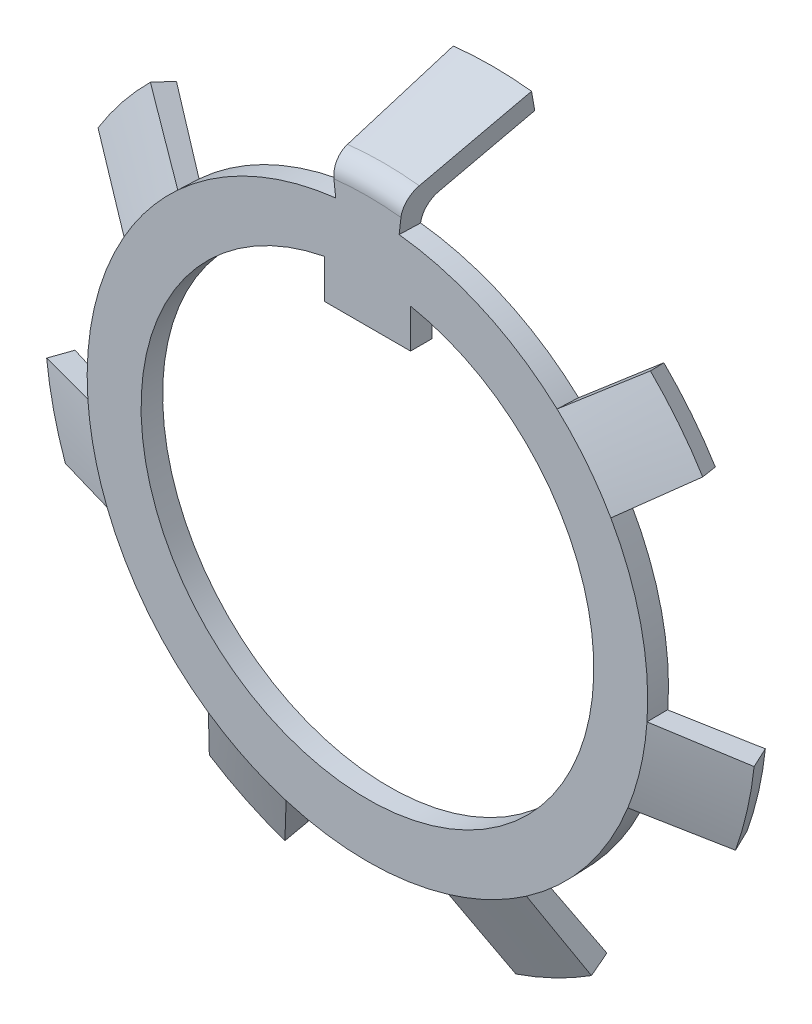
from build123d import *

# Parameters (mm, degrees)
CUT_EXTRUDE2_DEPTH           = 24.379246777
CUT_EXTRUDE2_DEPTH_BACK      = 24.379246777
CUT_EXTRUDE4_DEPTH           = 10
CUT_EXTRUDE4_DRAFT           = 2
CUT_EXTRUDE4_PROFILE_2_DEPTH = 10
CUT_EXTRUDE4_PROFILE_2_DRAFT = 2
CUT_EXTRUDE4_PROFILE_3_DEPTH = 10
CUT_EXTRUDE4_PROFILE_3_DRAFT = 2
CUT_EXTRUDE4_PROFILE_4_DEPTH = 10
CUT_EXTRUDE4_PROFILE_4_DRAFT = 2
CUT_EXTRUDE4_PROFILE_5_DEPTH = 10
CUT_EXTRUDE4_PROFILE_5_DRAFT = 2
CUT_EXTRUDE4_PROFILE_6_DEPTH = 10
CUT_EXTRUDE4_PROFILE_6_DRAFT = 2
REVOLVE3_ANGLE               = 13
FILLET1_R                    = 1


with BuildPart() as part:
    # Sketch1 → Revolve1 (revolve)
    with BuildSketch(Plane(origin=(0, 0, 0), x_dir=(0, 0, -1), z_dir=(1, 0, 0))):
        Polygon((-1, 7.5), (-1, 13), (0.529028795, 16.5), (1.445399555, 16.099669349), (0, 13), (0, 7.5), align=None)
    revolve(axis=Axis((0, 0, 1), (0, 0, -1)))

    # Sketch2 → Cut-Extrude2 (cut, two sides: drawn at the far end of the back side and taken through both)
    with BuildSketch(Plane.XY.offset(-CUT_EXTRUDE2_DEPTH_BACK)):
        with BuildLine():
            Line((-2, 8.5), (-2, 10.307764064))
            ThreePointArc((-2, 10.307764064), (0, -10.5), (2, 10.307764064))
            Line((2, 10.307764064), (2, 8.5))
            Line((2, 8.5), (-2, 8.5))
        make_face()
    extrude(amount=CUT_EXTRUDE2_DEPTH + CUT_EXTRUDE2_DEPTH_BACK, mode=Mode.SUBTRACT)


with BuildPart() as cut_extrude4_tool:
    # Sketch3 → Cut-Extrude4 (with draft: the straight prism first)
    with BuildSketch(Plane.XY.offset(1)):
        with BuildLine():
            Line((-11.558121734, 11.775390524), (-8.795827626, 9.57253448))
            ThreePointArc((-8.795827626, 9.57253448), (0, 13), (8.795827626, 9.57253448))
            Line((8.795827626, 9.57253448), (11.558121734, 11.775390524))
            ThreePointArc((11.558121734, 11.775390524), (0, 16.5), (-11.558121734, 11.775390524))
        make_face()
    extrude(amount=-CUT_EXTRUDE4_DEPTH)
    # Cut-Extrude4: the draft: its side faces are tilted about the plane it starts from
    cut_extrude4_sides = [cut_extrude4_tool.faces().sort_by_distance(p)[0] for p in [
        (-10.17697468, 10.673962502, -4),
        (0, 13, -4),
        (10.17697468, 10.673962502, -4),
        (0, 16.5, -4),
    ]]
    draft(cut_extrude4_sides, Plane.XY.offset(1), CUT_EXTRUDE4_DRAFT)


with BuildPart() as part_1:
    add(part.part)

    # Cut-Extrude4: cut by cut_extrude4_tool
    add(cut_extrude4_tool.part, mode=Mode.SUBTRACT)


with BuildPart() as cut_extrude4_profile_2_tool:
    # Sketch3 → Cut-Extrude4 profile 2 (with draft: the straight prism first)
    with BuildSketch(Plane.XY.offset(1)):
        with BuildLine():
            ThreePointArc((16.412742059, -1.694667545), (16.086310551, 3.67159541), (14.052080941, 8.648064594))
            Line((14.052080941, 8.648064594), (11.289786833, 6.44520855))
            ThreePointArc((11.289786833, 6.44520855), (12.674062858, 2.892772141), (12.968217647, -0.908477326))
            Line((12.968217647, -0.908477326), (16.412742059, -1.694667545))
        make_face()
    extrude(amount=-CUT_EXTRUDE4_PROFILE_2_DEPTH)
    # Cut-Extrude4 profile 2: the draft: its side faces are tilted about the plane it starts from
    cut_extrude4_profile_2_sides = [cut_extrude4_profile_2_tool.faces().sort_by_distance(p)[0] for p in [
        (12.670933887, 7.546636572, -4),
        (12.674062858, 2.892772141, -4),
        (14.690479853, -1.301572436, -4),
        (16.086310551, 3.67159541, -4),
    ]]
    draft(cut_extrude4_profile_2_sides, Plane.XY.offset(1), CUT_EXTRUDE4_PROFILE_2_DRAFT)


with BuildPart() as part_2:
    add(part_1.part)

    # Cut-Extrude4 profile 2: cut by cut_extrude4_profile_2_tool
    add(cut_extrude4_profile_2_tool.part, mode=Mode.SUBTRACT)


with BuildPart() as cut_extrude4_profile_3_tool:
    # Sketch3 → Cut-Extrude4 profile 3 (with draft: the straight prism first)
    with BuildSketch(Plane.XY.offset(1)):
        with BuildLine():
            Line((-11.289786833, 6.44520855), (-14.052080941, 8.648064594))
            ThreePointArc((-14.052080941, 8.648064594), (-16.086310551, 3.67159541), (-16.412742059, -1.694667545))
            Line((-16.412742059, -1.694667545), (-12.968217647, -0.908477326))
            ThreePointArc((-12.968217647, -0.908477326), (-12.674062858, 2.892772141), (-11.289786833, 6.44520855))
        make_face()
    extrude(amount=-CUT_EXTRUDE4_PROFILE_3_DEPTH)
    # Cut-Extrude4 profile 3: the draft: its side faces are tilted about the plane it starts from
    cut_extrude4_profile_3_sides = [cut_extrude4_profile_3_tool.faces().sort_by_distance(p)[0] for p in [
        (-16.086310551, 3.67159541, -4),
        (-14.690479853, -1.301572436, -4),
        (-12.674062858, 2.892772141, -4),
        (-12.670933887, 7.546636572, -4),
    ]]
    draft(cut_extrude4_profile_3_sides, Plane.XY.offset(1), CUT_EXTRUDE4_PROFILE_3_DRAFT)


with BuildPart() as part_3:
    add(part_2.part)

    # Cut-Extrude4 profile 3: cut by cut_extrude4_profile_3_tool
    add(cut_extrude4_profile_3_tool.part, mode=Mode.SUBTRACT)


with BuildPart() as cut_extrude4_profile_4_tool:
    # Sketch3 → Cut-Extrude4 profile 4 (with draft: the straight prism first)
    with BuildSketch(Plane.XY.offset(1)):
        with BuildLine():
            Line((-12.078133911, -4.808188975), (-15.522658324, -5.594379194))
            ThreePointArc((-15.522658324, -5.594379194), (-12.900219461, -10.287581731), (-8.908232855, -13.888606388))
            Line((-8.908232855, -13.888606388), (-7.375275277, -10.705387176))
            ThreePointArc((-7.375275277, -10.705387176), (-10.163809272, -8.105367424), (-12.078133911, -4.808188975))
        make_face()
    extrude(amount=-CUT_EXTRUDE4_PROFILE_4_DEPTH)
    # Cut-Extrude4 profile 4: the draft: its side faces are tilted about the plane it starts from
    cut_extrude4_profile_4_sides = [cut_extrude4_profile_4_tool.faces().sort_by_distance(p)[0] for p in [
        (-13.800396118, -5.201284084, -4),
        (-12.900219461, -10.287581731, -4),
        (-8.141754066, -12.296996782, -4),
        (-10.163809272, -8.105367424, -4),
    ]]
    draft(cut_extrude4_profile_4_sides, Plane.XY.offset(1), CUT_EXTRUDE4_PROFILE_4_DRAFT)


with BuildPart() as part_4:
    add(part_3.part)

    # Cut-Extrude4 profile 4: cut by cut_extrude4_profile_4_tool
    add(cut_extrude4_profile_4_tool.part, mode=Mode.SUBTRACT)


with BuildPart() as cut_extrude4_profile_5_tool:
    # Sketch3 → Cut-Extrude4 profile 5 (with draft: the straight prism first)
    with BuildSketch(Plane.XY.offset(1)):
        with BuildLine():
            ThreePointArc((8.908232855, -13.888606388), (12.900219461, -10.287581731), (15.522658324, -5.594379194))
            Line((15.522658324, -5.594379194), (12.078133911, -4.808188975))
            ThreePointArc((12.078133911, -4.808188975), (10.163809272, -8.105367424), (7.375275277, -10.705387176))
            Line((7.375275277, -10.705387176), (8.908232855, -13.888606388))
        make_face()
    extrude(amount=-CUT_EXTRUDE4_PROFILE_5_DEPTH)
    # Cut-Extrude4 profile 5: the draft: its side faces are tilted about the plane it starts from
    cut_extrude4_profile_5_sides = [cut_extrude4_profile_5_tool.faces().sort_by_distance(p)[0] for p in [
        (12.900219461, -10.287581731, -4),
        (13.800396118, -5.201284084, -4),
        (10.163809272, -8.105367424, -4),
        (8.141754066, -12.296996782, -4),
    ]]
    draft(cut_extrude4_profile_5_sides, Plane.XY.offset(1), CUT_EXTRUDE4_PROFILE_5_DRAFT)


with BuildPart() as part_5:
    add(part_4.part)

    # Cut-Extrude4 profile 5: cut by cut_extrude4_profile_5_tool
    add(cut_extrude4_profile_5_tool.part, mode=Mode.SUBTRACT)


with BuildPart() as cut_extrude4_profile_6_tool:
    # Sketch3 → Cut-Extrude4 profile 6 (with draft: the straight prism first)
    with BuildSketch(Plane.XY.offset(1)):
        with BuildLine():
            Line((-3.771399805, -12.440922133), (-5.304357384, -15.624141344))
            ThreePointArc((-5.304357384, -15.624141344), (0, -16.5), (5.304357384, -15.624141344))
            Line((5.304357384, -15.624141344), (3.771399805, -12.440922133))
            ThreePointArc((3.771399805, -12.440922133), (0, -13), (-3.771399805, -12.440922133))
        make_face()
    extrude(amount=-CUT_EXTRUDE4_PROFILE_6_DEPTH)
    # Cut-Extrude4 profile 6: the draft: its side faces are tilted about the plane it starts from
    cut_extrude4_profile_6_sides = [cut_extrude4_profile_6_tool.faces().sort_by_distance(p)[0] for p in [
        (0, -16.5, -4),
        (4.537878594, -14.032531738, -4),
        (0, -13, -4),
        (-4.537878594, -14.032531738, -4),
    ]]
    draft(cut_extrude4_profile_6_sides, Plane.XY.offset(1), CUT_EXTRUDE4_PROFILE_6_DRAFT)


with BuildPart() as part_6:
    add(part_5.part)

    # Cut-Extrude4 profile 6: cut by cut_extrude4_profile_6_tool
    add(cut_extrude4_profile_6_tool.part, mode=Mode.SUBTRACT)

    # Sketch4 → Revolve3 (revolve, symmetric)
    with BuildSketch(Plane(origin=(0, 0, 0), x_dir=(0, 0, -1), z_dir=(1, 0, 0))) as revolve3_sk:
        Polygon((-1, 10), (-1, 14.5), (4.795554958, 16.052914271), (5.054374003, 15.086988444), (0, 13.732673012), (0, 10), align=None)
    revolve(axis=Axis((0, 0, 1), (0, 0, -1)), revolution_arc=REVOLVE3_ANGLE / 2)
    revolve(revolve3_sk.sketch, axis=Axis((0, 0, 1), (0, 0, 1)), revolution_arc=REVOLVE3_ANGLE / 2)

    # Fillet1
    fillet1_edges = [part_6.edges().sort_by_distance(p)[0] for p in [
        (0, 14.5, 1),
        (0, 13.732673012, 0),
    ]]
    fillet(fillet1_edges, radius=FILLET1_R)


solid = part_6.part
